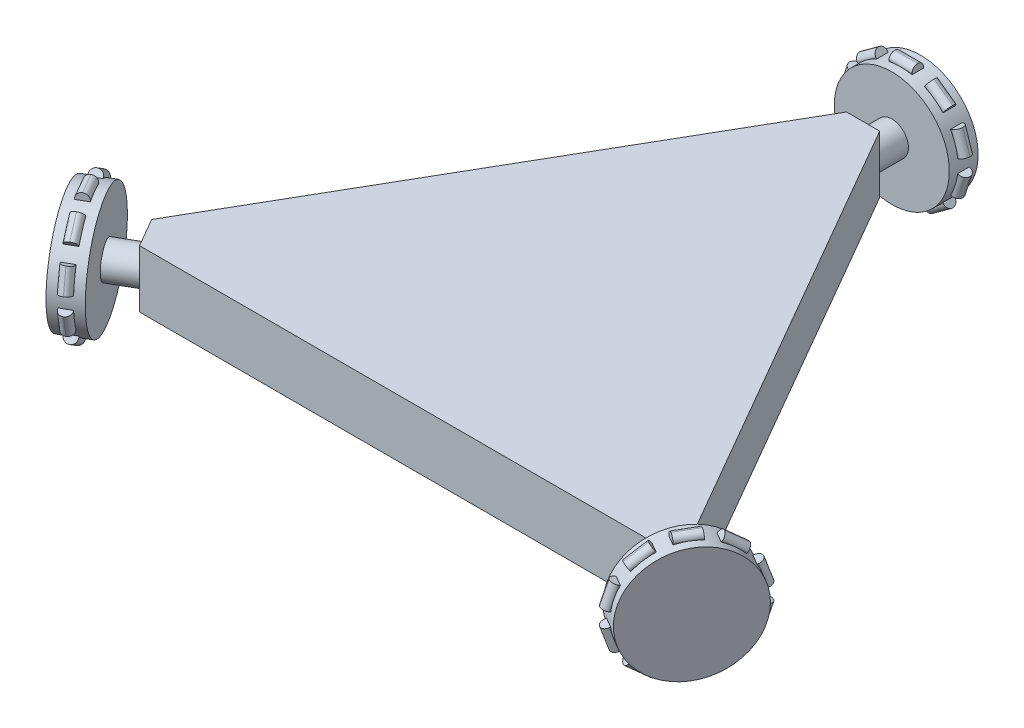
from build123d import *

# Parameters (mm, degrees)
SALIENTE_EXTRUIR1_DEPTH  = 10
CROQUIS2_R               = 2.886751346
SALIENTE_EXTRUIR2_DEPTH  = 5
CROQUIS3_R               = 2.886751346
SALIENTE_EXTRUIR3_DEPTH  = 5
CROQUIS4_R               = 2.886751346
SALIENTE_EXTRUIR4_DEPTH  = 5
CROQUIS5_R               = 10
SALIENTE_EXTRUIR5_DEPTH  = 5
CROQUIS6_W               = 4
CROQUIS6_H               = 2
SALIENTE_EXTRUIR6_DEPTH  = 1
REDONDEO1_R              = 1
MATRIZC1_COUNT           = 10
REDONDEO1_OF_MATRIZC1_R  = 1
CROQUIS7_R               = 10
SALIENTE_EXTRUIR7_DEPTH  = 5
CROQUIS8_R               = 10
SALIENTE_EXTRUIR8_DEPTH  = 5
CROQUIS9_W               = 4
CROQUIS9_H               = 2
SALIENTE_EXTRUIR9_DEPTH  = 1
REDONDEO2_R              = 1
MATRIZC2_COUNT           = 10
REDONDEO2_OF_MATRIZC2_R  = 1
CROQUIS10_W              = 4
CROQUIS10_H              = 2
SALIENTE_EXTRUIR10_DEPTH = 1
REDONDEO3_R              = 1
MATRIZC3_COUNT           = 10
REDONDEO3_OF_MATRIZC3_R  = 1


with BuildPart() as part:
    # Croquis1 → Saliente-Extruir1 (new body)
    with BuildSketch(Plane(origin=(0, 0, 0), x_dir=(1, 0, 0), z_dir=(0, 1, 0))):
        Polygon((-44.226497308, -36.89286226), (44.226497308, -36.89286226), (47.113248654, -31.89286226), (2.886751346, 44.709678118), (-2.886751346, 44.709678118), (-47.113248654, -31.89286226), align=None)
    extrude(amount=SALIENTE_EXTRUIR1_DEPTH)

    # Croquis2 → Saliente-Extruir2 (add)
    with BuildSketch(Plane(origin=(49.144950949, 0, 28.37385066), x_dir=(0.4999999999999952, 0, -0.8660254037844414), z_dir=(0.8660254037844414, 0, 0.4999999999999952))):
        with Locations((-6.950155936, 5)):
            Circle(CROQUIS2_R)
    extrude(amount=SALIENTE_EXTRUIR2_DEPTH)

    # Croquis3 → Saliente-Extruir3 (add)
    with BuildSketch(Plane(origin=(-49.144950949, 0, 28.37385066), x_dir=(0.4999999999999982, 0, 0.8660254037844397), z_dir=(-0.8660254037844398, 0, 0.4999999999999983))):
        with Locations((6.950155936, 5)):
            Circle(CROQUIS3_R)
    extrude(amount=SALIENTE_EXTRUIR3_DEPTH)

    # Croquis4 → Saliente-Extruir4 (add)
    with BuildSketch(Plane(origin=(0, 0, -44.709678118), x_dir=(-1, 0, 0), z_dir=(0, 0, -1))):
        with Locations((0, 5)):
            Circle(CROQUIS4_R)
    extrude(amount=SALIENTE_EXTRUIR4_DEPTH)

    # Croquis5 → Saliente-Extruir5 (add)
    with BuildSketch(Plane(origin=(-53.475077968, 0, 30.87385066), x_dir=(0.49999999999999833, 0, 0.8660254037844396), z_dir=(-0.8660254037844396, 0, 0.49999999999999833))):
        with Locations((6.950155936, 5)):
            Circle(CROQUIS5_R)
    extrude(amount=SALIENTE_EXTRUIR5_DEPTH)

    # Croquis6 → Saliente-Extruir6 (add, symmetric)
    with BuildSketch(Plane(origin=(-55.640141477, 0, 32.12385066), x_dir=(0.4999999999999984, 0, 0.8660254037844397), z_dir=(-0.8660254037844397, 0, 0.4999999999999984))):
        with Locations((6.950155936, 15)):
            Rectangle(CROQUIS6_W, CROQUIS6_H)
    saliente_extruir6 = extrude(amount=SALIENTE_EXTRUIR6_DEPTH, both=True)

    # Redondeo1
    redondeo1_edges = [part.edges().sort_by_distance(p)[0] for p in [
        (-51.299038106, 16, 37.64286226),
        (-53.031088913, 16, 38.64286226),
    ]]
    fillet(redondeo1_edges, radius=REDONDEO1_R - 0.0001)  # a hair under: the kernel refuses the full size

    # MatrizC1: Saliente-Extruir6 ×10 about axis
    matrizc1_axis = Axis((3.475077968, 5, 6.019011601), (0.8660254037844407, 0, -0.4999999999999967))
    for i in range(1, MATRIZC1_COUNT):
        add(saliente_extruir6.rotate(matrizc1_axis, i * 360 / MATRIZC1_COUNT))

    # Redondeo1 of MatrizC1
    redondeo1_of_matrizc1_edges = [part.edges().sort_by_distance(p)[0] for p in [
        (-48.066219218, 13.899186938, 43.242268825),
        (-49.798270026, 13.899186938, 44.242268825),
        (-46.068227266, 8.399186938, 46.702892399),
        (-47.800278074, 8.399186938, 47.702892399),
        (-46.068227266, 1.600813062, 46.702892399),
        (-47.800278074, 1.600813062, 47.702892399),
        (-48.066219218, -3.899186938, 43.242268825),
        (-49.798270026, -3.899186938, 44.242268825),
        (-51.299038106, -6, 37.64286226),
        (-53.031088913, -6, 38.64286226),
        (-54.531856993, -3.899186938, 32.043455695),
        (-56.263907801, -3.899186938, 33.043455695),
        (-56.529848945, 1.600813062, 28.582832121),
        (-58.261899753, 1.600813062, 29.582832121),
        (-56.529848945, 8.399186938, 28.582832121),
        (-58.261899753, 8.399186938, 29.582832121),
        (-54.531856993, 13.899186938, 32.043455695),
        (-56.263907801, 13.899186938, 33.043455695),
    ]]
    fillet(redondeo1_of_matrizc1_edges, radius=REDONDEO1_OF_MATRIZC1_R - 0.0001)  # a hair under: the kernel refuses the full size

    # Croquis7 → Saliente-Extruir7 (add)
    with BuildSketch(Plane(origin=(0, 0, -49.709678118), x_dir=(-1, 0, 0), z_dir=(0, 0, -1))):
        with Locations((0, 5)):
            Circle(CROQUIS7_R)
    extrude(amount=SALIENTE_EXTRUIR7_DEPTH)

    # Croquis8 → Saliente-Extruir8 (add)
    with BuildSketch(Plane(origin=(53.475077968, 0, 30.87385066), x_dir=(0.4999999999999952, 0, -0.8660254037844415), z_dir=(0.8660254037844415, 0, 0.4999999999999953))):
        with Locations((-6.950155936, 5)):
            Circle(CROQUIS8_R)
    extrude(amount=SALIENTE_EXTRUIR8_DEPTH)

    # Croquis9 → Saliente-Extruir9 (add, symmetric)
    with BuildSketch(Plane(origin=(0, 0, -52.209678118), x_dir=(-1, 0, 0), z_dir=(0, 0, -1))):
        with Locations((0, 15)):
            Rectangle(CROQUIS9_W, CROQUIS9_H)
    saliente_extruir9 = extrude(amount=SALIENTE_EXTRUIR9_DEPTH, both=True)

    # Redondeo2
    redondeo2_edges = [part.edges().sort_by_distance(p)[0] for p in [
        (0, 16, -51.209678118),
        (0, 16, -53.209678118),
    ]]
    fillet(redondeo2_edges, radius=REDONDEO2_R - 0.0001)  # a hair under: the kernel refuses the full size

    # MatrizC2: Saliente-Extruir9 ×10 about axis
    matrizc2_axis = Axis((0, 5, 0), (0, 0, 1))
    for i in range(1, MATRIZC2_COUNT):
        add(saliente_extruir9.rotate(matrizc2_axis, i * 360 / MATRIZC2_COUNT))

    # Redondeo2 of MatrizC2
    redondeo2_of_matrizc2_edges = [part.edges().sort_by_distance(p)[0] for p in [
        (-6.465637775, 13.899186938, -51.209678118),
        (-6.465637775, 13.899186938, -53.209678118),
        (-10.461621679, 8.399186938, -51.209678118),
        (-10.461621679, 8.399186938, -53.209678118),
        (-10.461621679, 1.600813062, -51.209678118),
        (-10.461621679, 1.600813062, -53.209678118),
        (-6.465637775, -3.899186938, -51.209678118),
        (-6.465637775, -3.899186938, -53.209678118),
        (0, -6, -51.209678118),
        (0, -6, -53.209678118),
        (6.465637775, -3.899186938, -51.209678118),
        (6.465637775, -3.899186938, -53.209678118),
        (10.461621679, 1.600813062, -51.209678118),
        (10.461621679, 1.600813062, -53.209678118),
        (10.461621679, 8.399186938, -51.209678118),
        (10.461621679, 8.399186938, -53.209678118),
        (6.465637775, 13.899186938, -51.209678118),
        (6.465637775, 13.899186938, -53.209678118),
    ]]
    fillet(redondeo2_of_matrizc2_edges, radius=REDONDEO2_OF_MATRIZC2_R - 0.0001)  # a hair under: the kernel refuses the full size

    # Croquis10 → Saliente-Extruir10 (add, symmetric)
    with BuildSketch(Plane(origin=(55.640141477, 0, 32.12385066), x_dir=(0.4999999999999954, 0, -0.8660254037844414), z_dir=(0.8660254037844413, 0, 0.49999999999999534))):
        with Locations((-6.950155936, 15)):
            Rectangle(CROQUIS10_W, CROQUIS10_H)
    saliente_extruir10 = extrude(amount=SALIENTE_EXTRUIR10_DEPTH, both=True)

    # Redondeo3
    redondeo3_edges = [part.edges().sort_by_distance(p)[0] for p in [
        (51.299038106, 16, 37.64286226),
        (53.031088913, 16, 38.64286226),
    ]]
    fillet(redondeo3_edges, radius=REDONDEO3_R - 0.0001)  # a hair under: the kernel refuses the full size

    # MatrizC3: Saliente-Extruir10 ×10 about axis
    matrizc3_axis = Axis((-3.475077968, 5, 6.019011601), (-0.8660254037844413, 0, -0.49999999999999534))
    for i in range(1, MATRIZC3_COUNT):
        add(saliente_extruir10.rotate(matrizc3_axis, i * 360 / MATRIZC3_COUNT))

    # Redondeo3 of MatrizC3
    redondeo3_of_matrizc3_edges = [part.edges().sort_by_distance(p)[0] for p in [
        (54.531856993, 13.899186938, 32.043455695),
        (56.263907801, 13.899186938, 33.043455695),
        (56.529848945, 8.399186938, 28.582832121),
        (58.261899753, 8.399186938, 29.582832121),
        (56.529848945, 1.600813062, 28.582832121),
        (58.261899753, 1.600813062, 29.582832121),
        (54.531856993, -3.899186938, 32.043455695),
        (56.263907801, -3.899186938, 33.043455695),
        (51.299038106, -6, 37.64286226),
        (53.031088913, -6, 38.64286226),
        (48.066219218, -3.899186938, 43.242268825),
        (49.798270026, -3.899186938, 44.242268825),
        (46.068227266, 1.600813062, 46.702892399),
        (47.800278074, 1.600813062, 47.702892399),
        (46.068227266, 8.399186938, 46.702892399),
        (47.800278074, 8.399186938, 47.702892399),
        (48.066219218, 13.899186938, 43.242268825),
        (49.798270026, 13.899186938, 44.242268825),
    ]]
    fillet(redondeo3_of_matrizc3_edges, radius=REDONDEO3_OF_MATRIZC3_R - 0.0001)  # a hair under: the kernel refuses the full size


solid = part.part
